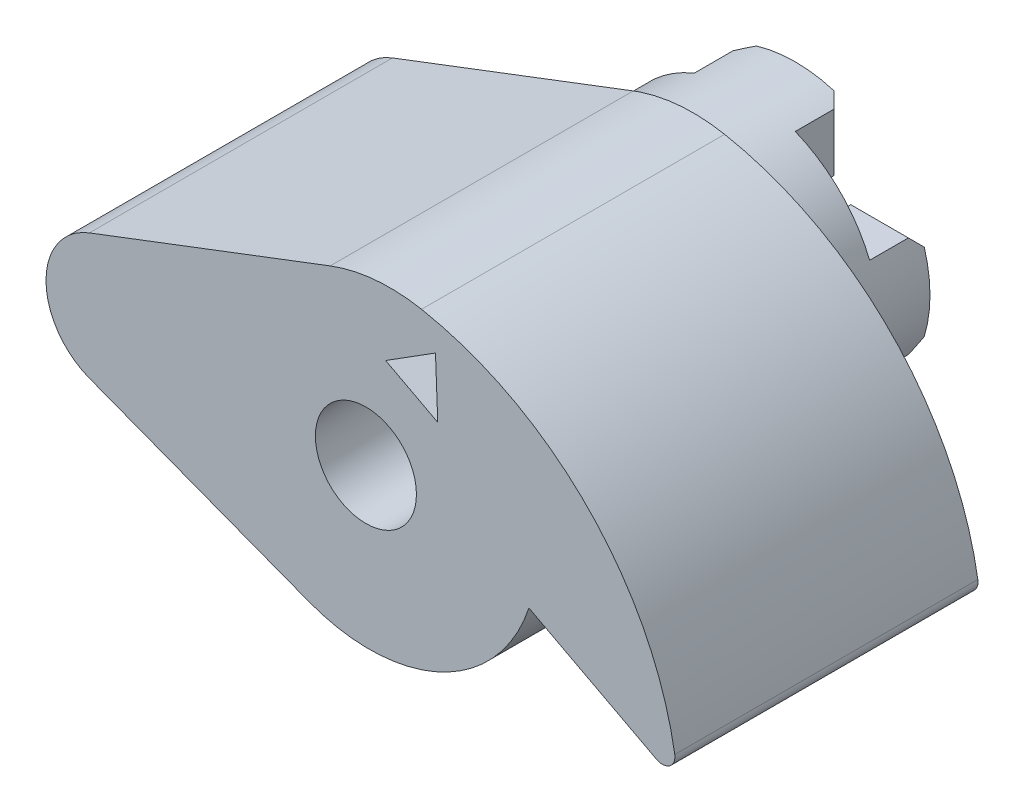
from build123d import *
from build123d.topology import SkipClean

# Parameters (mm, degrees)
ESBO_O1_R                      = 3
ESBO_O1_R_2                    = 4
RESSALTO_EXTRUS_O1_DEPTH       = 18
FILETE1_R                      = 0.75
FILETE2_R                      = 10
CORTE_EXTRUS_O1_DEPTH          = 4
FILETE3_START                  = -1
FILETE3_DEPTH                  = 20
RESSALTO_EXTRUS_O2_START       = 4.5
ESBO_O3_R                      = 8
ESBO_O3_R_2                    = 3
RESSALTO_EXTRUS_O2_DEPTH       = 4.5
FILETE4_R                      = 1.5
RESSALTO_EXTRUS_O3_DEPTH       = 3
RESSALTO_EXTRUS_O3_2_OUTLINE_R = 3
RESSALTO_EXTRUS_O3_2_DEPTH     = 3
CHANFRO1_SIZE                  = 0.7
CORTE_EXTRUS_O2_DEPTH          = 32.051703035
CORTE_EXTRUS_O2_DEPTH_BACK     = 32.051703035
ESBO_O5_R                      = 3


with BuildPart() as part:
    # Esboço1 → Ressalto-extrusão1 (new body)
    # profile 1 of 2: a face of its own
    with BuildSketch(Plane.XY):
        with BuildLine():
            ThreePointArc((18.527777033, -7.165767596), (12.575893163, 4.991910238), (0, 10))
            Line((0, 10), (-16.425033333, 3.73755))
            ThreePointArc((-16.425033333, 3.73755), (-12.730653545, 3.293943938), (-11, 0))
            ThreePointArc((-11, 0), (-12.730653545, -3.293943938), (-16.425033333, -3.73755))
            Line((-16.425033333, -3.73755), (0, -10))
            ThreePointArc((0, -10), (6.122948149, -7.906295338), (9.681967281, -2.501901193))
            Line((9.681967281, -2.501901193), (18.527777033, -7.165767596))
        make_face()
        Circle(ESBO_O1_R, mode=Mode.SUBTRACT)
    # profile 2 of 2: a face of its own
    with BuildSketch(Plane.XY):
        with Locations((-15, 0)):
            Circle(ESBO_O1_R_2)
    extrude(amount=RESSALTO_EXTRUS_O1_DEPTH)

    # Filete1
    filete1_edges = [part.edges().sort_by_distance(p)[0] for p in [
        (18.527777033, -7.165767596, 9),
    ]]
    fillet(filete1_edges, radius=FILETE1_R)

    # Filete2
    filete2_edges = [part.edges().sort_by_distance(p)[0] for p in [
        (0, 10, 9),
    ]]
    fillet(filete2_edges, radius=FILETE2_R)

    # Esboço2 → Corte-extrusão1 (cut)
    with BuildSketch(Plane.XY.offset(18)):
        Polygon((4.131679723, 7.836427896), (1.170003642, 5.97136093), (4.266037055, 4.339007689), align=None)
    extrude(amount=-CORTE_EXTRUS_O1_DEPTH, mode=Mode.SUBTRACT)

    # Filete3: read off the stored shape, not the designer's step
    # Filete3 outline → Filete3 (cut)
    with BuildSketch(Plane.XY.offset(FILETE3_START)):
        with BuildLine():
            ThreePointArc((0, -10), (6.122948149, -7.906295338), (9.681967281, -2.501901193))
            ThreePointArc((9.681967281, -2.501901193), (4.480336522, -8.399311502), (-3.377040528, -8.712419815))
            Line((-3.377040528, -8.712419815), (0, -10))
        make_face()
    extrude(amount=FILETE3_DEPTH, mode=Mode.SUBTRACT)

    # Esboço3 → Ressalto-extrusão2 (add)
    with SkipClean():  # the faces are left unmerged after this step: merging them gives an invalid solid
        with BuildSketch(Plane(origin=(0, 0, 0), x_dir=(-1, 0, 0), z_dir=(0, 0, -1)).offset(RESSALTO_EXTRUS_O2_START)):
            with Locations(Location((0, 0, 0), (0, 0, 180))):
                Circle(ESBO_O3_R)
            Circle(ESBO_O3_R_2, mode=Mode.SUBTRACT)
        extrude(amount=-RESSALTO_EXTRUS_O2_DEPTH)

    # Filete4
    filete4_edges = [part.edges().sort_by_distance(p)[0] for p in [
        (-8, 0, 0),
    ]]
    fillet(filete4_edges, radius=FILETE4_R)

    # Ressalto-extrusão3: read off the stored shape, not the designer's step
    # Ressalto-extrusão3 outline → Ressalto-extrusão3 (add)
    with SkipClean():  # the faces are left unmerged after this step: merging them gives an invalid solid
        with BuildSketch(Plane(origin=(0, 0, -4.5), x_dir=(-1, 0, 0), z_dir=(0, 0, -1))):
            with BuildLine():
                ThreePointArc((7.416198487, -3), (8, 0), (7.416198487, 3))
                Line((7.416198487, 3), (4, 3))
                Line((4, 3), (4, -3))
                Line((4, -3), (7.416198487, -3))
            make_face()
            with BuildLine():
                Line((3, 4), (3, 7.416198487))
                ThreePointArc((3, 7.416198487), (0, 8), (-3, 7.416198487))
                Line((-3, 7.416198487), (-3, 4))
                Line((-3, 4), (3, 4))
            make_face()
            with BuildLine():
                ThreePointArc((-3, -7.416198487), (0, -8), (3, -7.416198487))
                Line((3, -7.416198487), (3, -4))
                Line((3, -4), (-3, -4))
                Line((-3, -4), (-3, -7.416198487))
            make_face()
            with BuildLine():
                Line((-4, 3), (-7.416198487, 3))
                ThreePointArc((-7.416198487, 3), (-8, 0), (-7.416198487, -3))
                Line((-7.416198487, -3), (-4, -3))
                Line((-4, -3), (-4, 3))
            make_face()
        extrude(amount=RESSALTO_EXTRUS_O3_DEPTH)

    # Chanfro1
    chanfro1_edges = [part.edges().sort_by_distance(p)[0] for p in [
        (4, 0, -7.5),
        (5.708099243, 3, -7.5),
        (5.708099243, -3, -7.5),
        (-5.708099243, 3, -7.5),
        (-4, 0, -7.5),
        (-5.708099243, -3, -7.5),
        (0, -4, -7.5),
        (3, -5.708099243, -7.5),
        (-3, -5.708099243, -7.5),
        (3, 5.708099243, -7.5),
        (0, 4, -7.5),
        (-3, 5.708099243, -7.5),
    ]]
    chamfer(chanfro1_edges, length=CHANFRO1_SIZE)


with BuildPart() as body_2:
    # Ressalto-extrus_o3 2 outline → Ressalto-extrus_o3 2 (new body)
    with BuildSketch(Plane(origin=(0, 0, -4.5), x_dir=(-1, 0, 0), z_dir=(0, 0, -1))):
        Circle(RESSALTO_EXTRUS_O3_2_OUTLINE_R)
    extrude(amount=RESSALTO_EXTRUS_O3_2_DEPTH)

    # Esboço5 → Corte-extrusão2 (cut, two sides: drawn at the far end of the back side and taken through both)
    with BuildSketch(Plane.XY.offset(-4.5).offset(-CORTE_EXTRUS_O2_DEPTH_BACK)):
        with Locations(Location((0, 0, 0), (0, 0, 180))):
            Circle(ESBO_O5_R)
    extrude(amount=CORTE_EXTRUS_O2_DEPTH + CORTE_EXTRUS_O2_DEPTH_BACK, mode=Mode.SUBTRACT)


solid = part.part
